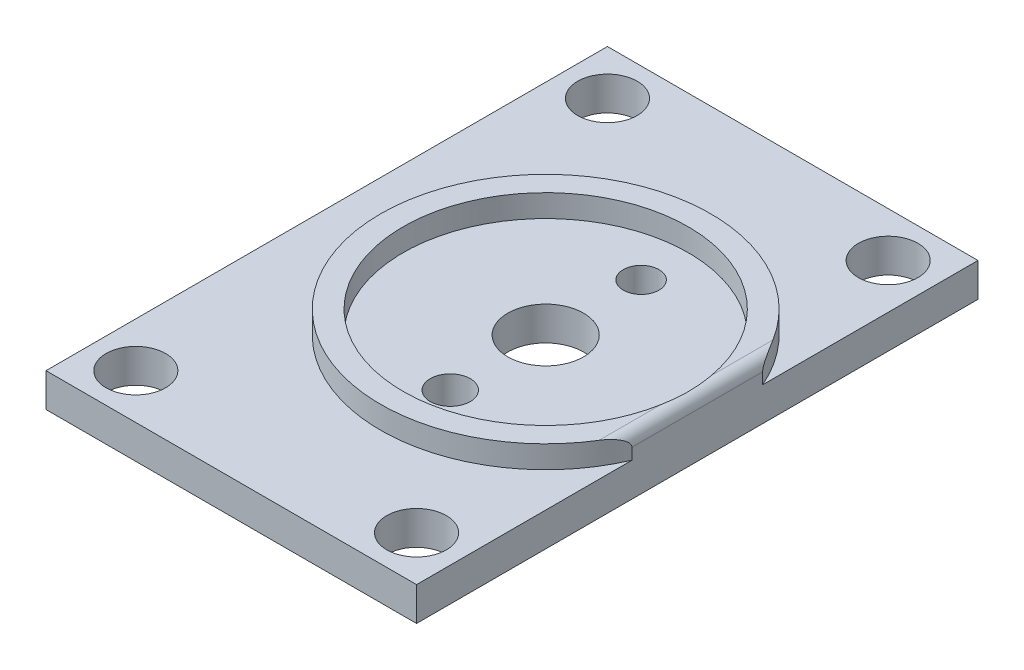
from build123d import *

# Parameters (mm, degrees)
SKETCH1_W           = 25
SKETCH1_H           = 50
SKETCH1_R           = 3.375
BOSS_EXTRUDE1_DEPTH = 3
SKETCH2_W           = 50
SKETCH2_H           = 3
BOSS_EXTRUDE2_DEPTH = 8
SKETCH3_W           = 8
SKETCH3_H           = 50
BOSS_EXTRUDE3_DEPTH = 42
SKETCH4_R           = 2.65
CUT_EXTRUDE1_DEPTH  = 3.3
SKETCH5_R           = 5.802370205
CUT_EXTRUDE2_DEPTH  = 9
FILLET2_R           = 1
SKETCH6_R           = 12.7
BOSS_EXTRUDE4_DEPTH = 2
FILLET4_R           = 1
SKETCH8_R           = 1.589780168
SKETCH8_R_2         = 1.777428262
CUT_EXTRUDE3_DEPTH  = 10
SKETCH9_W           = 8
SKETCH9_H           = 42
CUT_EXTRUDE4_DEPTH  = 68.79439129


with BuildPart() as part:
    # Sketch1 → Boss-Extrude1 (new body)
    with BuildSketch(Plane(origin=(0, 0, 0), x_dir=(1, 0, 0), z_dir=(0, 1, 0))):
        with Locations((2.276951673, 11.384758364)):
            Rectangle(SKETCH1_W, SKETCH1_H)
        with Locations(Location((1.276951673, 11.384758364, 0), (0, 0, 270))):
            Circle(SKETCH1_R, mode=Mode.SUBTRACT)
    extrude(amount=BOSS_EXTRUDE1_DEPTH)

    # Sketch2 → Boss-Extrude2 (add)
    with BuildSketch(Plane.ZY.offset(10.223048327)):
        with Locations((-11.384758364, 1.5)):
            Rectangle(SKETCH2_W, SKETCH2_H)
    extrude(amount=BOSS_EXTRUDE2_DEPTH)

    # Sketch3 → Boss-Extrude3 (add)
    with BuildSketch(Plane.XZ):
        with Locations((-14.223048327, -11.384758364)):
            Rectangle(SKETCH3_W, SKETCH3_H)
    extrude(amount=BOSS_EXTRUDE3_DEPTH)

    # Sketch4 → Cut-Extrude1 (cut)
    with BuildSketch(Plane(origin=(0, 3, 0), x_dir=(1, 0, 0), z_dir=(0, 1, 0))):
        with Locations(Location((-14.223048327, 32.384758364, 0), (0, 0, 270))):
            Circle(SKETCH4_R)
        with Locations(Location((-14.223048327, -9.615241636, 0), (0, 0, 270))):
            Circle(SKETCH4_R)
    cut_extrude1 = extrude(amount=-CUT_EXTRUDE1_DEPTH, mode=Mode.SUBTRACT)

    # Mirror1: Cut-Extrude1 across plane
    add(cut_extrude1.mirror(Plane.ZX.offset(-19.5)), mode=Mode.SUBTRACT)

    # Sketch5 → Cut-Extrude2 (cut)
    with BuildSketch(Plane.ZY.offset(18.223048327)):
        with Locations((-11.836279124, -21)):
            Circle(SKETCH5_R)
    extrude(amount=-CUT_EXTRUDE2_DEPTH, mode=Mode.SUBTRACT)

    # Fillet2
    fillet2_edges = [part.edges().sort_by_distance(p)[0] for p in [
        (-10.223048327, -21, -17.638649329),
    ]]
    fillet(fillet2_edges, radius=FILLET2_R)

    # Mirror2: Cut-Extrude1 across plane
    add(cut_extrude1.mirror(Plane.ZY.offset(1.723048327)), mode=Mode.SUBTRACT)

    # Sketch6 → Boss-Extrude4 (add)
    with BuildSketch(Plane(origin=(0, 3, 0), x_dir=(1, 0, 0), z_dir=(0, 1, 0))):
        with BuildLine():
            Line((14.776951673, 5.567542535), (14.776951673, 17.201974193))
            ThreePointArc((14.776951673, 17.201974193), (-13.423048327, 11.384758364), (14.776951673, 5.567542535))
        make_face()
        with Locations(Location((1.276951673, 11.384758364, 0), (0, 0, 270))):
            Circle(SKETCH6_R, mode=Mode.SUBTRACT)
    extrude(amount=BOSS_EXTRUDE4_DEPTH)

    # Fillet4
    # the kernel refuses this fillet: 1 mm, written as the material it takes off along each edge
    with BuildSketch(Plane(origin=(14.776951673, 5, -3.067542535), x_dir=(0, -1, 0), z_dir=(0, 0, -1))) as fillet4_piece_1:
        with BuildLine():
            CenterArc((FILLET4_R, FILLET4_R), FILLET4_R, 180, 90)
            Line((0, FILLET4_R), (0, 0))
            Line((0, 0), (FILLET4_R, 0))
        make_face()
    extrude(amount=16.634431658, mode=Mode.SUBTRACT)

    # Sketch8 → Cut-Extrude3 (cut)
    with BuildSketch(Plane(origin=(0, 3, 0), x_dir=(1, 0, 0), z_dir=(0, 1, 0))):
        with Locations(Location((1.276951673, 19.884758364, 0), (0, 0, 270))):
            Circle(SKETCH8_R)
        with Locations(Location((1.276951673, 2.884758364, 0), (0, 0, 270))):
            Circle(SKETCH8_R_2)
    extrude(amount=-CUT_EXTRUDE3_DEPTH, mode=Mode.SUBTRACT)

    # Sketch9 → Cut-Extrude4 (cut, through all)
    with BuildSketch(Plane.XY.offset(13.615241636)):
        with Locations((-14.223048327, -21)):
            Rectangle(SKETCH9_W, SKETCH9_H)
    extrude(amount=-CUT_EXTRUDE4_DEPTH, mode=Mode.SUBTRACT)


solid = part.part
